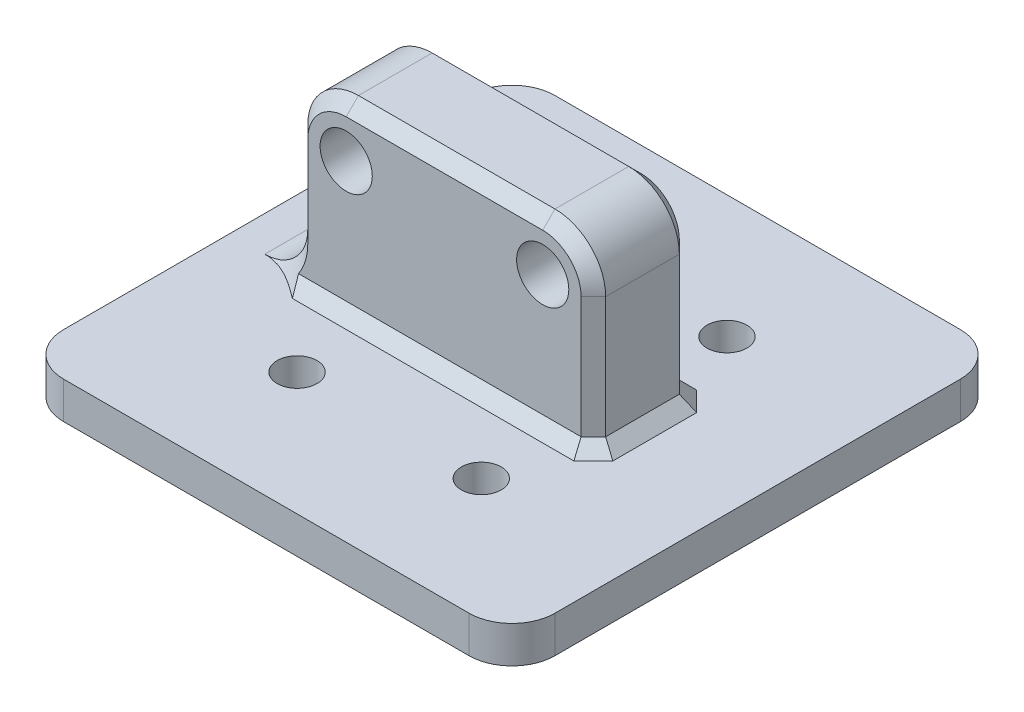
from build123d import *

# Parameters (mm, degrees)
SKETCH1_W           = 40
SKETCH1_H           = 40
BOSS_EXTRUDE1_DEPTH = 3
FILLET1_R           = 3.5
SKETCH2_R           = 2.125
BOSS_EXTRUDE2_DEPTH = 4
FILLET2_R           = 3.5
CHAMFER1_SIZE       = 1
CHAMFER2_SIZE       = 1
SKETCH4_R           = 1.625
CUT_EXTRUDE4_DEPTH  = 10


with BuildPart() as part:
    # Sketch1 → Boss-Extrude1 (new body)
    with BuildSketch(Plane(origin=(0, 0, 0), x_dir=(1, 0, 0), z_dir=(0, 1, 0))):
        Rectangle(SKETCH1_W, SKETCH1_H)
    extrude(amount=BOSS_EXTRUDE1_DEPTH)

    # Fillet1
    fillet1_edges = [part.edges().sort_by_distance(p)[0] for p in [
        (-20, 1.5, 20),
        (-20, 1.5, -20),
        (20, 1.5, -20),
        (20, 1.5, 20),
    ]]
    fillet(fillet1_edges, radius=FILLET1_R)

    # Sketch2 → Boss-Extrude2 (add, symmetric)
    with BuildSketch(Plane.XY):
        with BuildLine():
            Line((-1.5, 0), (10.625, 0))
            Line((10.625, 0), (10.625, 13.875))
            ThreePointArc((10.625, 13.875), (9.416815472, 16.791815472), (6.5, 18))
            Line((6.5, 18), (-9.5, 18))
            ThreePointArc((-9.5, 18), (-12.416815472, 16.791815472), (-13.625, 13.875))
            Line((-13.625, 13.875), (-13.625, 0))
            Line((-13.625, 0), (-1.5, 0))
        make_face()
        with Locations((-9.5, 13.875)):
            Circle(SKETCH2_R, mode=Mode.SUBTRACT)
        with Locations((6.5, 13.875)):
            Circle(SKETCH2_R, mode=Mode.SUBTRACT)
    extrude(amount=BOSS_EXTRUDE2_DEPTH, both=True)

    # Fillet2
    fillet2_edges = [part.edges().sort_by_distance(p)[0] for p in [
        (-13.625, 3, 0),
    ]]
    fillet(fillet2_edges, radius=FILLET2_R)

    # Chamfer1
    # the kernel refuses this chamfer: 1 mm, written as the material it takes off along each edge
    with BuildSketch(Plane(origin=(-17.125, 6.5, -4), x_dir=(-0.6706329473594386, -0.7417893568365567, 0), z_dir=(-0.7417893568365567, 0.6706329473594386, 0))) as chamfer1_piece_1_section:
        Polygon((3.5, CHAMFER1_SIZE), (3.5 + CHAMFER1_SIZE, 0), (3.5, 0), align=None)
    chamfer1_piece_1 = revolve(axis=Axis((-17.125, 6.5, -4), (0, 0, 1)), revolution_arc=132.115934794, mode=Mode.PRIVATE)
    chamfer1_piece_1 = split(chamfer1_piece_1, bisect_by=Plane(origin=(-14.562264523, 3, -3.629385384), z_dir=(0, 1, 0)), keep=Keep.TOP, mode=Mode.PRIVATE)
    add(chamfer1_piece_1, mode=Mode.SUBTRACT)
    with BuildSketch(Plane(origin=(-17.125, 6.5, 4), x_dir=(-0.6706329473594386, -0.7417893568365567, 0), z_dir=(-0.7417893568365567, 0.6706329473594386, 0))) as chamfer1_piece_2_section:
        Polygon((3.5, -CHAMFER1_SIZE), (3.5 + CHAMFER1_SIZE, 0), (3.5, 0), align=None)
    chamfer1_piece_2 = revolve(axis=Axis((-17.125, 6.5, 4), (0, 0, 1)), revolution_arc=132.115934794, mode=Mode.PRIVATE)
    chamfer1_piece_2 = split(chamfer1_piece_2, bisect_by=Plane(origin=(-14.562264523, 3, 3.629385384), z_dir=(0, 1, 0)), keep=Keep.TOP, mode=Mode.PRIVATE)
    add(chamfer1_piece_2, mode=Mode.SUBTRACT)
    with BuildSketch(Plane(origin=(10.625, 3, 4), x_dir=(-0.9996219169112968, 0, 0.02749587661058651), z_dir=(0, 1, 0)), Plane(origin=(10.625, 3, -4), x_dir=(0.027495876610585623, 0, 0.9996219169112968), z_dir=(0, 1, 0))) as chamfer1_piece_3:
        Polygon((CHAMFER1_SIZE * 0.999621916911, -CHAMFER1_SIZE * 0.0274958766106), (-CHAMFER1_SIZE * 0.0274958766106, -CHAMFER1_SIZE * 0.999621916911), (0, 0), align=None)
    extrude(amount=10.875, mode=Mode.SUBTRACT)
    with BuildSketch(Plane(origin=(6.5, 13.875, 4), x_dir=(1, 0, 0), z_dir=(0, -1, 0))) as chamfer1_piece_4:
        Polygon((4.125, -CHAMFER1_SIZE), (4.125 - CHAMFER1_SIZE, 0), (4.125, 0), align=None)
    revolve(axis=Axis((6.5, 13.875, 4), (0, 0, 1)), revolution_arc=90, mode=Mode.SUBTRACT)
    with BuildSketch(Plane(origin=(6.5, 18, 4), x_dir=(0, 0.027495876610585623, -0.9996219169112968), z_dir=(-1, 0, 0))) as chamfer1_piece_5:
        Polygon((CHAMFER1_SIZE * 0.999621916911, CHAMFER1_SIZE * 0.0274958766106), (-CHAMFER1_SIZE * 0.0274958766106, CHAMFER1_SIZE * 0.999621916911), (0, 0), align=None)
    extrude(amount=16, mode=Mode.SUBTRACT)
    with BuildSketch(Plane(origin=(-9.5, 13.875, 4), x_dir=(0, 1, 0), z_dir=(1, 0, 0))) as chamfer1_piece_6:
        Polygon((4.125, -CHAMFER1_SIZE), (4.125 - CHAMFER1_SIZE, 0), (4.125, 0), align=None)
    revolve(axis=Axis((-9.5, 13.875, 4), (0, 0, 1)), revolution_arc=90, mode=Mode.SUBTRACT)
    with BuildSketch(Plane(origin=(-13.625, 13.875, 4), x_dir=(-0.027495876610585623, 0, -0.9996219169112968), z_dir=(0, -1, 0))) as chamfer1_piece_7:
        Polygon((CHAMFER1_SIZE * 0.999621916911, CHAMFER1_SIZE * 0.0274958766106), (-CHAMFER1_SIZE * 0.0274958766106, CHAMFER1_SIZE * 0.999621916911), (0, 0), align=None)
    extrude(amount=7.375, mode=Mode.SUBTRACT)
    with BuildSketch(Plane(origin=(6.5, 13.875, -4), x_dir=(1, 0, 0), z_dir=(0, -1, 0))) as chamfer1_piece_8:
        Polygon((4.125, CHAMFER1_SIZE), (4.125 - CHAMFER1_SIZE, 0), (4.125, 0), align=None)
    revolve(axis=Axis((6.5, 13.875, -4), (0, 0, 1)), revolution_arc=90, mode=Mode.SUBTRACT)
    with BuildSketch(Plane(origin=(6.5, 18, -4), x_dir=(0, 0.027495876610585623, 0.9996219169112968), z_dir=(-1, 0, 0))) as chamfer1_piece_9:
        Polygon((CHAMFER1_SIZE * 0.999621916911, -CHAMFER1_SIZE * 0.0274958766106), (-CHAMFER1_SIZE * 0.0274958766106, -CHAMFER1_SIZE * 0.999621916911), (0, 0), align=None)
    extrude(amount=16, mode=Mode.SUBTRACT)
    with BuildSketch(Plane(origin=(-9.5, 13.875, -4), x_dir=(0, 1, 0), z_dir=(1, 0, 0))) as chamfer1_piece_10:
        Polygon((4.125, CHAMFER1_SIZE), (4.125 - CHAMFER1_SIZE, 0), (4.125, 0), align=None)
    revolve(axis=Axis((-9.5, 13.875, -4), (0, 0, 1)), revolution_arc=90, mode=Mode.SUBTRACT)
    with BuildSketch(Plane(origin=(-13.625, 13.875, -4), x_dir=(-0.027495876610585623, 0, 0.9996219169112968), z_dir=(0, -1, 0))) as chamfer1_piece_11:
        Polygon((CHAMFER1_SIZE * 0.999621916911, -CHAMFER1_SIZE * 0.0274958766106), (-CHAMFER1_SIZE * 0.0274958766106, -CHAMFER1_SIZE * 0.999621916911), (0, 0), align=None)
    extrude(amount=7.375, mode=Mode.SUBTRACT)

    # Chamfer2
    chamfer2_edges = [part.edges().sort_by_distance(p)[0] for p in [
        (-2.335786438, 3, -4),
        (10.625, 3, 0),
        (-2.335786438, 3, 4),
        (10.125, 3, -3.5),
        (10.125, 3, 3.5),
    ]]
    chamfer(chamfer2_edges, length=CHAMFER2_SIZE)

    # Sketch4 → Cut-Extrude4 (cut)
    with BuildSketch(Plane(origin=(0, 0, 0), x_dir=(1, 0, 0), z_dir=(0, 1, 0))):
        with Locations(Location((-7.5, 10, 0), (0, 0, 270))):
            Circle(SKETCH4_R)
        with Locations(Location((7.5, 10, 0), (0, 0, 270))):
            Circle(SKETCH4_R)
        with Locations(Location((7.5, -10, 0), (0, 0, 270))):
            Circle(SKETCH4_R)
        with Locations(Location((-7.5, -10, 0), (0, 0, 270))):
            Circle(SKETCH4_R)
    extrude(amount=CUT_EXTRUDE4_DEPTH, mode=Mode.SUBTRACT)


solid = part.part
